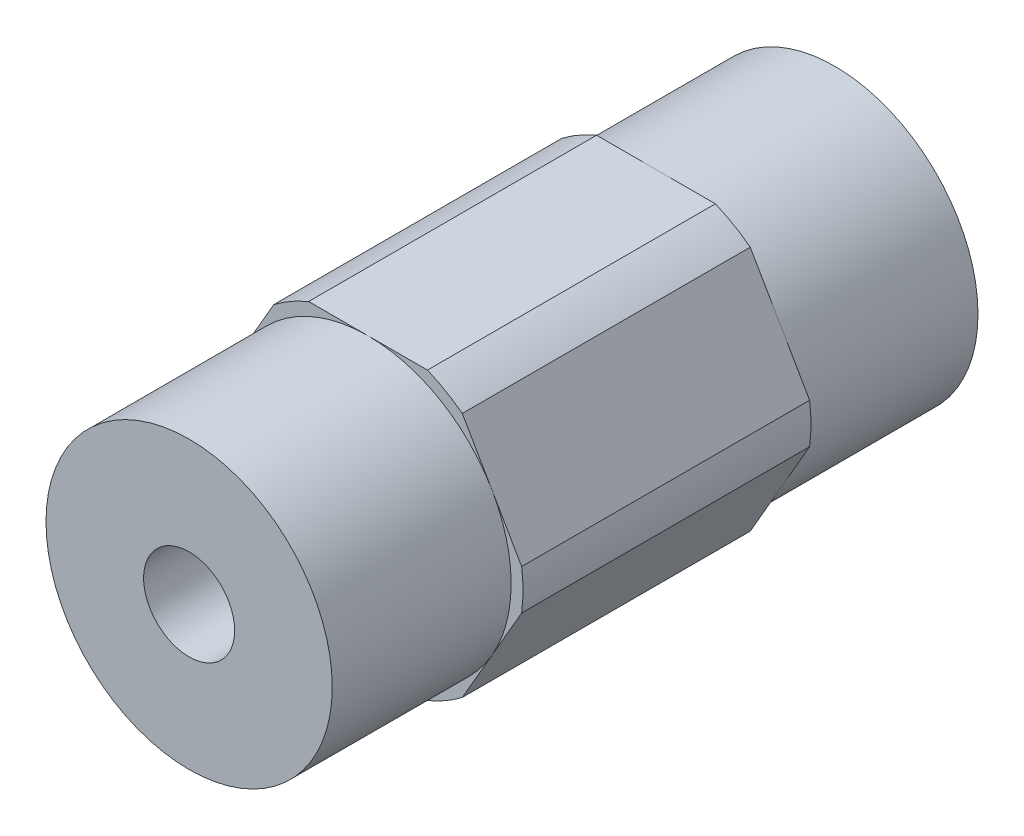
from build123d import *

# Parameters (mm, degrees)
SKETCH1_R                            = 2.0193
BOSS_EXTRUDE1_DEPTH                  = 14.3256
F_10_32_TAPPED_HOLE1_D               = 4.0386
F_10_32_TAPPED_HOLE1_DEPTH           = 11.938
F_10_32_TAPPED_HOLE1_TIP             = 1.213317848
F_10_32_TAPPED_HOLE1_ON_FACE_2_D     = 4.0386
F_10_32_TAPPED_HOLE1_ON_FACE_2_DEPTH = 11.938
F_10_32_TAPPED_HOLE1_ON_FACE_2_TIP   = 1.213317848
SKETCH4_R                            = 8.89
SKETCH4_R_2                          = 6.35
CUT_EXTRUDE_THIN1_DEPTH              = 7.9375


with BuildPart() as part:
    # Sketch1 → Boss-Extrude1 (new, symmetric)
    with BuildSketch(Plane.XY):
        with BuildLine():
            ThreePointArc((6.874999966, 0), (6.860422465, 0.447468582), (6.816751782, 0.893039571))
            Line((6.816751782, 0.893039571), (4.181770846, 5.456960429))
            ThreePointArc((4.181770846, 5.456960429), (3.437499983, 5.953924622), (2.634980936, 6.35))
            Line((2.634980936, 6.35), (-2.634980936, 6.35))
            ThreePointArc((-2.634980936, 6.35), (-3.437499983, 5.953924622), (-4.181770846, 5.456960429))
            Line((-4.181770846, 5.456960429), (-6.816751782, 0.893039571))
            ThreePointArc((-6.816751782, 0.893039571), (-6.874999966, 0), (-6.816751782, -0.893039571))
            Line((-6.816751782, -0.893039571), (-4.181770846, -5.456960429))
            ThreePointArc((-4.181770846, -5.456960429), (-3.437499983, -5.953924622), (-2.634980936, -6.35))
            Line((-2.634980936, -6.35), (2.634980936, -6.35))
            ThreePointArc((2.634980936, -6.35), (3.437499983, -5.953924622), (4.181770846, -5.456960429))
            Line((4.181770846, -5.456960429), (6.816751782, -0.893039571))
            ThreePointArc((6.816751782, -0.893039571), (6.860422465, -0.447468582), (6.874999966, 0))
        make_face()
        Circle(SKETCH1_R, mode=Mode.SUBTRACT)
    extrude(amount=BOSS_EXTRUDE1_DEPTH, both=True)

    # #10-32 Tapped Hole1
    with Locations(Plane.XY.offset(14.3256)):
        with Locations((0, 0)):
            Hole(F_10_32_TAPPED_HOLE1_D / 2, depth=F_10_32_TAPPED_HOLE1_DEPTH)
            with Locations((0, 0, -(F_10_32_TAPPED_HOLE1_DEPTH + F_10_32_TAPPED_HOLE1_TIP / 2))):  # 118° drill point
                Cone(0, F_10_32_TAPPED_HOLE1_D / 2, F_10_32_TAPPED_HOLE1_TIP, mode=Mode.SUBTRACT)

    # #10-32 Tapped Hole1 on face 2
    with Locations(Plane.XY.offset(-14.3256)):
        with Locations((0, 0)):
            Hole(F_10_32_TAPPED_HOLE1_ON_FACE_2_D / 2, depth=F_10_32_TAPPED_HOLE1_ON_FACE_2_DEPTH)
            with Locations((0, 0, -(F_10_32_TAPPED_HOLE1_ON_FACE_2_DEPTH + F_10_32_TAPPED_HOLE1_ON_FACE_2_TIP / 2))):  # 118° drill point
                Cone(0, F_10_32_TAPPED_HOLE1_ON_FACE_2_D / 2, F_10_32_TAPPED_HOLE1_ON_FACE_2_TIP, mode=Mode.SUBTRACT)

    # Sketch4 → Cut-Extrude-Thin1 (cut)
    with BuildSketch(Plane.XY.offset(14.3256)):
        Circle(SKETCH4_R)
        Circle(SKETCH4_R_2, mode=Mode.SUBTRACT)
    cut_extrude_thin1 = extrude(amount=-CUT_EXTRUDE_THIN1_DEPTH, mode=Mode.SUBTRACT)

    # Mirror1: Cut-Extrude-Thin1 across plane
    add(cut_extrude_thin1.mirror(Plane.XY), mode=Mode.SUBTRACT)


solid = part.part
